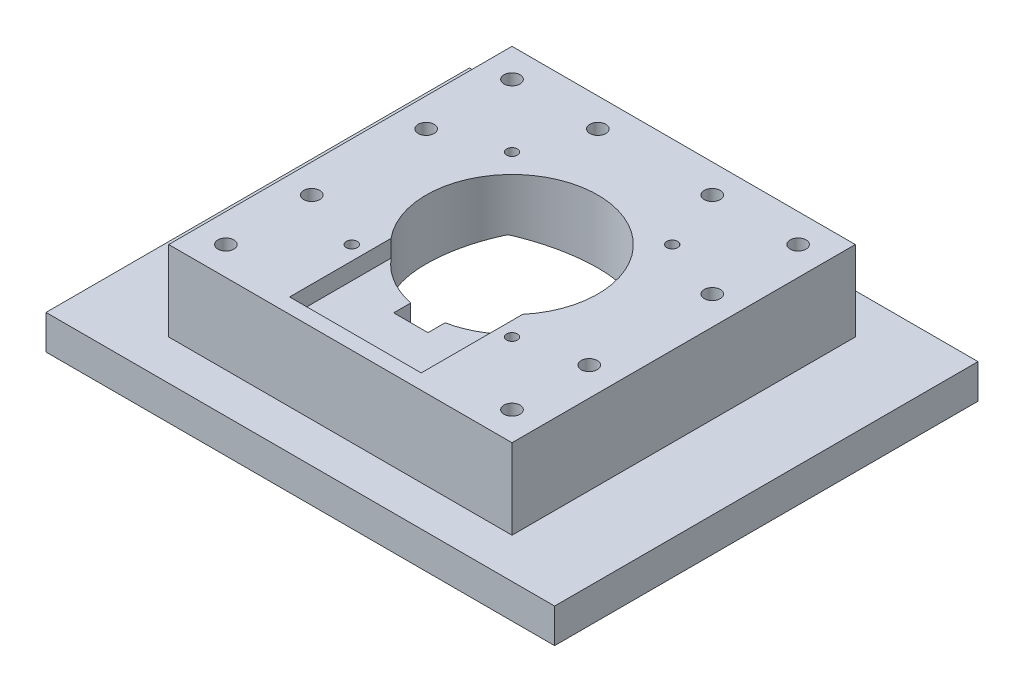
from build123d import *

# Parameters (mm, degrees)
SKETCH1_W           = 60
SKETCH1_H           = 60
BOSS_EXTRUDE1_DEPTH = 20
SKETCH10_W          = 15
SKETCH10_H          = 15
CUT_EXTRUDE4_DEPTH  = 8
SKETCH9_W           = 88.892246252
SKETCH9_H           = 74
SKETCH9_W_2         = 60
SKETCH9_H_2         = 60
BOSS_EXTRUDE4_DEPTH = 6
SKETCH2_R           = 15
CUT_EXTRUDE5_DEPTH  = 62.191975628
SKETCH11_R          = 0.95
CUT_EXTRUDE6_DEPTH  = 6
SKETCH12_W          = 23
SKETCH12_H          = 10.738639716
CUT_EXTRUDE7_DEPTH  = 3
SKETCH13_W          = 23
SKETCH13_H          = 7
CUT_EXTRUDE8_DEPTH  = 3
SKETCH14_R          = 1.4
CUT_EXTRUDE9_DEPTH  = 5
SKETCH15_W          = 6
SKETCH15_H          = 8
CUT_EXTRUDE10_DEPTH = 61.278170847


with BuildPart() as part:
    # Sketch1 → Boss-Extrude1 (new body)
    with BuildSketch(Plane(origin=(0, 0, 0), x_dir=(1, 0, 0), z_dir=(0, 1, 0))):
        Rectangle(SKETCH1_W, SKETCH1_H)
    extrude(amount=BOSS_EXTRUDE1_DEPTH)

    # Sketch10 → Cut-Extrude4 (cut)
    with BuildSketch(Plane(origin=(0, 20, 0), x_dir=(1, 0, 0), z_dir=(0, 1, 0))):
        Rectangle(SKETCH10_W, SKETCH10_H)
    extrude(amount=-CUT_EXTRUDE4_DEPTH, mode=Mode.SUBTRACT)

    # Sketch9 → Boss-Extrude4 (add)
    with BuildSketch(Plane.XZ):
        Rectangle(SKETCH9_W, SKETCH9_H)
        Rectangle(SKETCH9_W_2, SKETCH9_H_2, mode=Mode.SUBTRACT)
    extrude(amount=-BOSS_EXTRUDE4_DEPTH)

    # Cut-Loft2: read off the stored shape, not the designer's step
    # Cut-Loft2: loft between two sections, ruled curve by curve
    cut_loft2_from = [
        Edge.make_line((-7.5, 12, -7.5), (7.5, 12, -7.5)),
        Edge.make_line((7.5, 12, -7.5), (7.5, 12, 7.5)),
        Edge.make_line((-7.5, 12, 7.5), (-7.5, 12, -7.5)),
        Edge.make_line((7.5, 12, 7.5), (-7.5, 12, 7.5)),
    ]
    cut_loft2_to = [
        Edge.make_line((-44.446123126, 0, -37), (44.446123126, 0, -37)),
        Edge.make_line((44.446123126, 0, -37), (44.446123126, 0, 37)),
        Edge.make_line((-44.446123126, 0, 37), (-44.446123126, 0, -37)),
        Edge.make_line((44.446123126, 0, 37), (-44.446123126, 0, 37)),
    ]
    cut_loft2 = Solid(Shell([*[Face.make_surface_from_curves(cut_loft2_from[k], cut_loft2_to[k]) for k in range(4)], Face(Wire(cut_loft2_from)), Face(Wire(cut_loft2_to))]))
    add(cut_loft2, mode=Mode.SUBTRACT)

    # Sketch2 → Cut-Extrude5 (cut, through all)
    with BuildSketch(Plane(origin=(0, 20, 0), x_dir=(1, 0, 0), z_dir=(0, 1, 0))):
        with Locations(Location((0, 0, 0), (0, 0, 270))):
            Circle(SKETCH2_R)
    extrude(amount=-CUT_EXTRUDE5_DEPTH, mode=Mode.SUBTRACT)

    # Sketch11 → Cut-Extrude6 (cut)
    with BuildSketch(Plane(origin=(0, 20, 0), x_dir=(1, 0, 0), z_dir=(0, 1, 0))):
        with Locations(Location((-14, 14, 0), (0, 0, 270))):
            Circle(SKETCH11_R)
        with Locations(Location((14, 14, 0), (0, 0, 270))):
            Circle(SKETCH11_R)
        with Locations(Location((14, -14, 0), (0, 0, 270))):
            Circle(SKETCH11_R)
        with Locations(Location((-14, -14, 0), (0, 0, 270))):
            Circle(SKETCH11_R)
    extrude(amount=-CUT_EXTRUDE6_DEPTH, mode=Mode.SUBTRACT)

    # Sketch12 → Cut-Extrude7 (cut)
    with BuildSketch(Plane(origin=(0, 20, 0), x_dir=(1, 0, 0), z_dir=(0, 1, 0))):
        with Locations((0, -15)):
            Rectangle(SKETCH12_W, SKETCH12_H)
    extrude(amount=-CUT_EXTRUDE7_DEPTH, mode=Mode.SUBTRACT)

    # Sketch13 → Cut-Extrude8 (cut)
    with BuildSketch(Plane(origin=(0, 20, 0), x_dir=(1, 0, 0), z_dir=(0, 1, 0))):
        with Locations((0, -23.869319858)):
            Rectangle(SKETCH13_W, SKETCH13_H)
    extrude(amount=-CUT_EXTRUDE8_DEPTH, mode=Mode.SUBTRACT)

    # Sketch14 → Cut-Extrude9 (cut)
    with BuildSketch(Plane(origin=(0, 20, 0), x_dir=(1, 0, 0), z_dir=(0, 1, 0))):
        with Locations(Location((-25, 25, 0), (0, 0, 270))):
            Circle(SKETCH14_R)
        with Locations(Location((25, 25, 0), (0, 0, 270))):
            Circle(SKETCH14_R)
        with Locations(Location((25, -25, 0), (0, 0, 270))):
            Circle(SKETCH14_R)
        with Locations(Location((-25, -25, 0), (0, 0, 270))):
            Circle(SKETCH14_R)
        with Locations(Location((-10, 25, 0), (0, 0, 270))):
            Circle(SKETCH14_R)
        with Locations(Location((10, 25, 0), (0, 0, 270))):
            Circle(SKETCH14_R)
        with Locations(Location((-25, 10, 0), (0, 0, 270))):
            Circle(SKETCH14_R)
        with Locations(Location((-25, -10, 0), (0, 0, 270))):
            Circle(SKETCH14_R)
        with Locations(Location((25, 10, 0), (0, 0, 270))):
            Circle(SKETCH14_R)
        with Locations(Location((25, -11.506341958, 0), (0, 0, 270))):
            Circle(SKETCH14_R)
    extrude(amount=-CUT_EXTRUDE9_DEPTH, mode=Mode.SUBTRACT)

    # Sketch15 → Cut-Extrude10 (cut, through all)
    with BuildSketch(Plane(origin=(0, 17, 0), x_dir=(1, 0, 0), z_dir=(0, 1, 0))):
        with Locations((0, -13.684659929)):
            Rectangle(SKETCH15_W, SKETCH15_H)
    extrude(amount=-CUT_EXTRUDE10_DEPTH, mode=Mode.SUBTRACT)


solid = part.part
